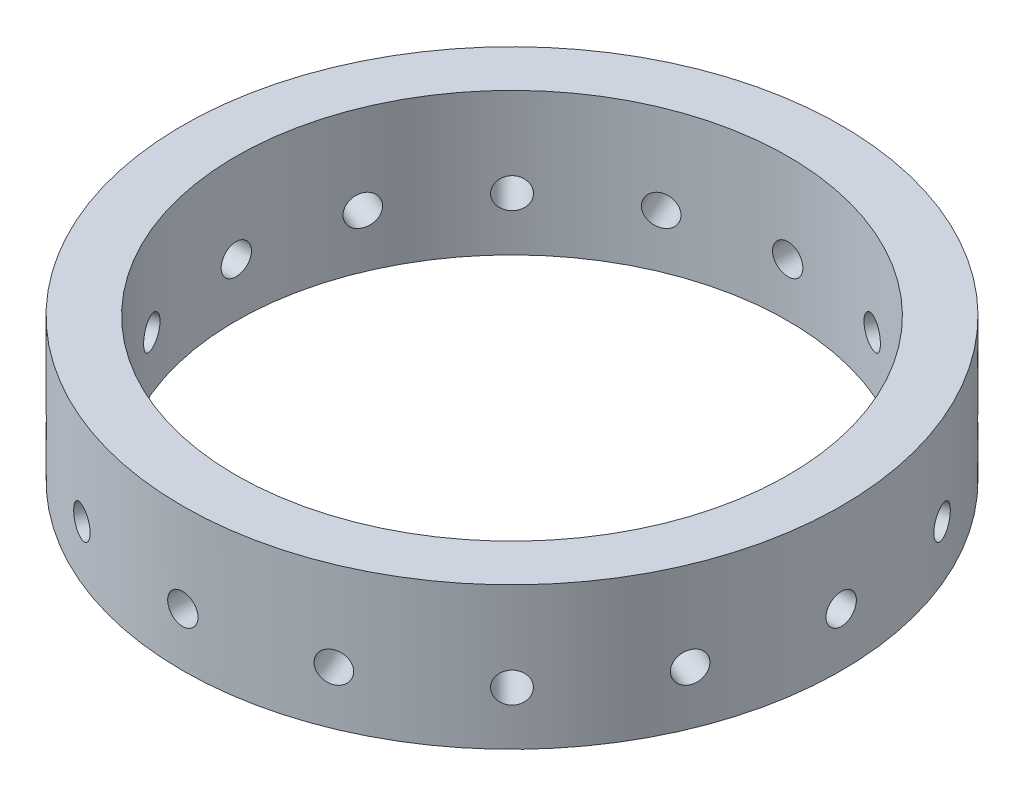
from build123d import *

# Parameters (mm, degrees)
SKETCH1_R                   = 58.7375
SKETCH1_R_2                 = 49.2125
BOSS_EXTRUDE1_DEPTH         = 25.4
TAP_DRILL_FOR_1_4_28_TAP1_D = 5.4102
CIRPATTERN1_COUNT           = 16


with BuildPart() as part:
    # Sketch1 → Boss-Extrude1 (new body)
    with BuildSketch(Plane(origin=(0, 0, 0), x_dir=(1, 0, 0), z_dir=(0, 1, 0))):
        Circle(SKETCH1_R)
        Circle(SKETCH1_R_2, mode=Mode.SUBTRACT)
    extrude(amount=BOSS_EXTRUDE1_DEPTH)

    # Tap Drill for 1/4-28 Tap1 (through all)
    with Locations(Plane(origin=(0, 0, -58.7375), x_dir=(-1, 0, 0), z_dir=(0, 0, -1))):
        with Locations((0, 9.525)):
            tap_drill_for_1_4_28_tap1 = Hole(TAP_DRILL_FOR_1_4_28_TAP1_D / 2)

    # CirPattern1: Tap Drill for 1/4-28 Tap1 ×16 about axis
    cirpattern1_axis = Axis((0, 0, 0), (0, 1, 0))
    for i in range(1, CIRPATTERN1_COUNT):
        add(tap_drill_for_1_4_28_tap1.rotate(cirpattern1_axis, i * 360 / CIRPATTERN1_COUNT), mode=Mode.SUBTRACT)


solid = part.part
